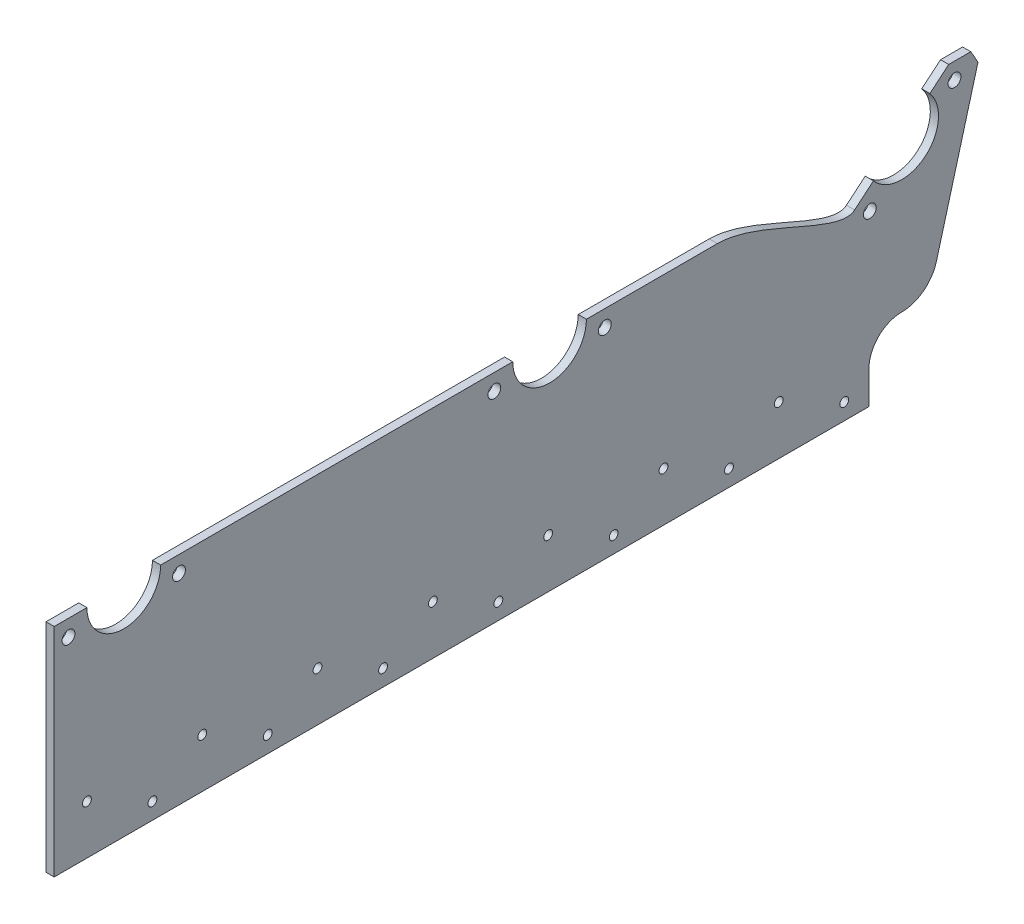
from build123d import *

# Parameters (mm, degrees)
BOSS_EXTRUDE1_DEPTH              = 3.175
F_10_CLEARANCE_HOLE1_D           = 4.9784
CHAMFER1_SIZE                    = 5.08
CHAMFER1_SIZE2                   = 4.134495326
F_1_8_0_135_DIAMETER_HOLE1_D     = 3.429
F_1_8_0_135_DIAMETER_HOLE1_DEPTH = 16.51
F_1_8_0_135_DIAMETER_HOLE1_TIP   = 1.030175531


with BuildPart() as part:
    # Sketch1 → Boss-Extrude1 (new body)
    with BuildSketch(Plane(origin=(0, 0, 0), x_dir=(0, 0, -1), z_dir=(1, 0, 0))):
        with BuildLine():
            Line((-12.7, -12.7), (-328.6125, -12.7))
            Line((-328.6125, -12.7), (-328.6125, 71.4375))
            Line((-328.6125, 71.4375), (-315.9125, 71.4375))
            ThreePointArc((-315.9125, 71.4375), (-301.625, 57.15), (-287.3375, 71.4375))
            Line((-287.3375, 71.4375), (-150.8125, 71.4375))
            ThreePointArc((-150.8125, 71.4375), (-136.525, 57.15), (-122.2375, 71.4375))
            Line((-122.2375, 71.4375), (-71.4375, 71.4375))
            add(Edge.make_bspline(
                [(-18.243165022, 56.129666959), (-24.729007974, 50.68739853), (-54.504166667, 71.4375), (-71.4375, 71.4375)],
                knots=[0, 0, 0, 0, 1, 1, 1, 1], degree=3))
            Line((-18.243165022, 56.129666959), (-10.944859981, 62.253672027))
            ThreePointArc((-10.944859981, 62.253672027), (9.183827973, 60.492640019), (10.944859981, 80.621327973))
            Line((10.944859981, 80.621327973), (18.243165022, 86.745333041))
            Line((18.243165022, 86.745333041), (30.943165022, 86.745333041))
            Line((30.943165022, 86.745333041), (13.473517024, 22.978761859))
            ThreePointArc((13.473517024, 22.978761859), (8.473319986, 15.563076555), (0, 12.7))
            ThreePointArc((0, 12.7), (-8.980256121, 8.980256121), (-12.7, 0))
            Line((-12.7, 0), (-12.7, -12.7))
        make_face()
    extrude(amount=BOSS_EXTRUDE1_DEPTH)

    # #10 Clearance Hole1 (through all)
    with Locations(Plane(origin=(3.175, 0, 0), x_dir=(0, 0, -1), z_dir=(1, 0, 0))):
        with Locations((-323.05625, 65.0875), (-280.19375, 65.0875), (-157.95625, 65.0875), (-115.09375, 65.0875), (-12.33558865, 52.797375826), (20.498991293, 80.348859746)):
            Hole(F_10_CLEARANCE_HOLE1_D / 2)

    # Chamfer1
    chamfer1_edges = [part.edges().sort_by_distance(p)[0] for p in [
        (1.5875, 86.745333041, -30.943165022),
    ]]
    chamfer1_side = [part.faces().sort_by_distance(p)[0] for p in [
        (1.5875, 54.86204745, -22.208341023),
    ]]
    chamfer(chamfer1_edges, length=CHAMFER1_SIZE, length2=CHAMFER1_SIZE2, reference=chamfer1_side[0])

    # 1/8 (0.135) Diameter Hole1
    with Locations(Plane(origin=(3.175, 0, 0), x_dir=(0, 0, -1), z_dir=(1, 0, 0))):
        with Locations((-22.2504, -6.35), (-47.6504, 6.35), (-66.96075, -6.35), (-92.36075, 6.35), (-111.6711, -6.35), (-137.0711, 6.35), (-156.38145, -6.35), (-181.78145, 6.35), (-201.0918, -6.35), (-226.4918, 6.35), (-245.80215, -6.35), (-271.20215, 6.35), (-290.5125, -6.35), (-315.9125, 6.35)):
            Hole(F_1_8_0_135_DIAMETER_HOLE1_D / 2, depth=F_1_8_0_135_DIAMETER_HOLE1_DEPTH)
            with Locations((0, 0, -(F_1_8_0_135_DIAMETER_HOLE1_DEPTH + F_1_8_0_135_DIAMETER_HOLE1_TIP / 2))):  # 118° drill point
                Cone(0, F_1_8_0_135_DIAMETER_HOLE1_D / 2, F_1_8_0_135_DIAMETER_HOLE1_TIP, mode=Mode.SUBTRACT)


solid = part.part
